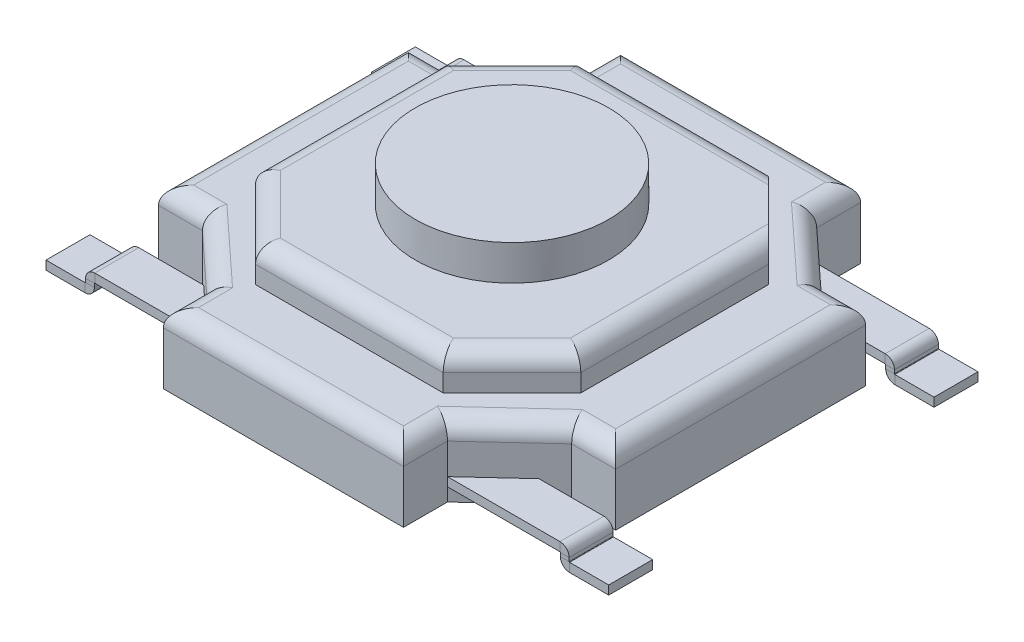
from build123d import *

# Parameters (mm, degrees)
SKETCH1_W               = 5.2
SKETCH1_H               = 5.2
BOSS_EXTRUDE1_DEPTH     = 0.8
BOSS_EXTRUDE2_DEPTH     = 0.4
SKETCH3_R               = 1.1
BOSS_EXTRUDE3_DEPTH     = 0.4
CUT_EXTRUDE1_DEPTH      = 4.762977544
BASE_FLANGE1_DEPTH      = 0.25
BASE_FLANGE1_DEPTH_BACK = 0.25
FILLET1_R               = 0.2
FILLET2_R               = 0.2


# Sheet-metal steps are written as plain solids
with BuildPart() as part:
    # Sketch1 → Boss-Extrude1 (new body)
    with BuildSketch(Plane(origin=(0, 0, 0), x_dir=(1, 0, 0), z_dir=(0, 1, 0))):
        Rectangle(SKETCH1_W, SKETCH1_H)
    extrude(amount=BOSS_EXTRUDE1_DEPTH)

    # Sketch2 → Boss-Extrude2 (add)
    with BuildSketch(Plane(origin=(0, 0.8, 0), x_dir=(1, 0, 0), z_dir=(0, 1, 0))):
        Polygon((-1.067602847, 1.85), (1.067602847, 1.85), (1.85, 1.067602847), (1.85, -1.067602847), (1.067602847, -1.85), (-1.067602847, -1.85), (-1.85, -1.067602847), (-1.85, 1.067602847), align=None)
    extrude(amount=BOSS_EXTRUDE2_DEPTH)

    # Sketch3 → Boss-Extrude3 (add)
    with BuildSketch(Plane(origin=(0, 1.2, 0), x_dir=(1, 0, 0), z_dir=(0, 1, 0))):
        with Locations(Location((0, 0, 0), (0, 0, 90))):
            Circle(SKETCH3_R)
    extrude(amount=BOSS_EXTRUDE3_DEPTH)

    # Sketch4 → Cut-Extrude1 (cut, through all)
    with BuildSketch(Plane(origin=(0, 0.8, 0), x_dir=(1, 0, 0), z_dir=(0, 1, 0))):
        Polygon((2.6, 2.6), (1.365741231, 2.6), (1.365741231, 2.1), (2.1, 1.421130307), (2.6, 1.421130307), align=None)
        Polygon((-1.365741231, 2.1), (-1.365741231, 2.6), (-2.6, 2.6), (-2.6, 1.421130307), (-2.1, 1.421130307), align=None)
        Polygon((-2.1, -1.421130307), (-2.6, -1.421130307), (-2.6, -2.6), (-1.365741231, -2.6), (-1.365741231, -2.1), align=None)
        Polygon((2.6, -2.6), (2.6, -1.421130307), (2.1, -1.421130307), (1.365741231, -2.1), (1.365741231, -2.6), align=None)
    extrude(amount=-CUT_EXTRUDE1_DEPTH, mode=Mode.SUBTRACT)

    # Fillet1
    fillet1_edges = [part.edges().sort_by_distance(p)[0] for p in [
        (-1.458801424, 1.2, -1.458801424),
        (-1.85, 1.2, 0),
        (-1.458801424, 1.2, 1.458801424),
        (0, 1.2, 1.85),
        (1.458801424, 1.2, 1.458801424),
        (1.85, 1.2, 0),
        (0, 1.2, -1.85),
    ]]
    fillet(fillet1_edges, radius=FILLET1_R)

    # Fillet2
    fillet2_edges = [part.edges().sort_by_distance(p)[0] for p in [
        (0, 0.8, -2.6),
        (1.365741231, 0.8, -2.35),
        (1.732870615, 0.8, -1.760565154),
        (2.35, 0.8, -1.421130307),
        (-2.6, 0.8, 0),
        (-2.35, 0.8, -1.421130307),
        (-1.365741231, 0.8, -2.35),
        (-1.732870615, 0.8, -1.760565154),
        (0, 0.8, 2.6),
        (-1.365741231, 0.8, 2.35),
        (-1.732870615, 0.8, 1.760565154),
        (-2.35, 0.8, 1.421130307),
        (2.6, 0.8, 0),
        (2.35, 0.8, 1.421130307),
        (1.365741231, 0.8, 2.35),
        (1.732870615, 0.8, 1.760565154),
    ]]
    fillet(fillet2_edges, radius=FILLET2_R)


with BuildPart() as body_2:
    # Sketch5 → Base-Flange1 (new, two sides: drawn at the far end of the back side and taken through both)
    with BuildSketch(Plane(origin=(0, 0, 1.85), x_dir=(-1, 0, 0), z_dir=(0, 0, -1)).offset(-BASE_FLANGE1_DEPTH_BACK)):
        with BuildLine():
            Line((-1.265741231, 0.15), (-2.645, 0.15))
            ThreePointArc((-2.645, 0.15), (-2.648535534, 0.148535534), (-2.65, 0.145))
            Line((-2.65, 0.145), (-2.65, 0.105))
            ThreePointArc((-2.65, 0.105), (-2.680753788, 0.030753788), (-2.755, 0))
            Line((-2.755, 0), (-3.2, 0))
            Line((-3.2, 0), (-3.2, 0.1))
            Line((-3.2, 0.1), (-2.755, 0.1))
            ThreePointArc((-2.755, 0.1), (-2.751464466, 0.101464466), (-2.75, 0.105))
            Line((-2.75, 0.105), (-2.75, 0.145))
            ThreePointArc((-2.75, 0.145), (-2.719246212, 0.219246212), (-2.645, 0.25))
            Line((-2.645, 0.25), (-1.265741231, 0.25))
            Line((-1.265741231, 0.25), (-1.265741231, 0.15))
        make_face()
    extrude(amount=BASE_FLANGE1_DEPTH + BASE_FLANGE1_DEPTH_BACK)


with BuildPart() as body_3:
    # Mirror1: mirrored copy
    add(body_2.part.mirror(Plane.ZY))


with BuildPart() as body_4:
    # Mirror2: mirrored copy
    add(body_3.part.mirror(Plane(origin=(0, 0, 0), x_dir=(1, 0, 0), z_dir=(0, 0, -1))))


with BuildPart() as body_5:
    # Mirror2 2: mirrored copy
    add(body_2.part.mirror(Plane(origin=(0, 0, 0), x_dir=(1, 0, 0), z_dir=(0, 0, -1))))


solid = Compound([part.part, body_2.part, body_3.part, body_4.part, body_5.part])
